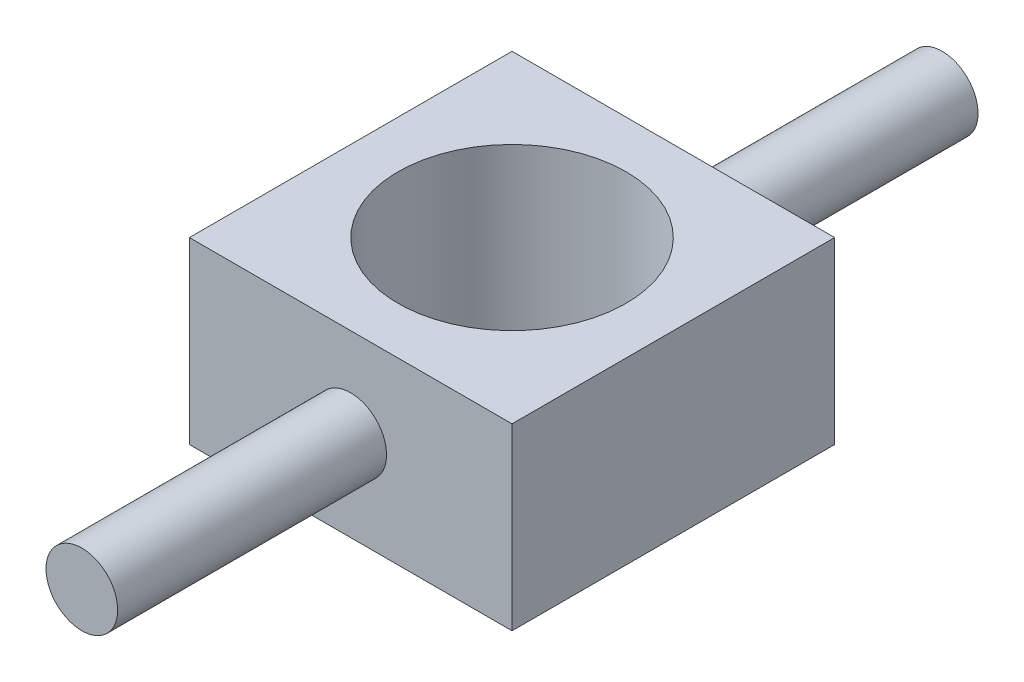
from build123d import *

# Parameters (mm, degrees)
BOSS_EXTRUDE1_DEPTH      = 10
BOSS_EXTRUDE1_DEPTH_BACK = 10
SKETCH1_W                = 36
SKETCH1_H                = 36
SKETCH2_R                = 12.725
CUT_EXTRUDE1_DEPTH       = 33.372828112
SKETCH5_R                = 4
BOSS_EXTRUDE2_DEPTH      = 30


with BuildPart() as part:
    # Sketch1 → Boss-Extrude1 (new, two sides: drawn at the far end of the back side and taken through both)
    with BuildSketch(Plane(origin=(0, 0, 0), x_dir=(1, 0, 0), z_dir=(0, 1, 0)).offset(-BOSS_EXTRUDE1_DEPTH_BACK)):
        Rectangle(SKETCH1_W, SKETCH1_H)
    extrude(amount=BOSS_EXTRUDE1_DEPTH + BOSS_EXTRUDE1_DEPTH_BACK)

    # Sketch2 → Cut-Extrude1 (cut, through all)
    with BuildSketch(Plane.XZ.offset(10)):
        Circle(SKETCH2_R)
    extrude(amount=-CUT_EXTRUDE1_DEPTH, mode=Mode.SUBTRACT)

    # Sketch5 → Boss-Extrude2 (add)
    with BuildSketch(Plane(origin=(0, 0, -18), x_dir=(-1, 0, 0), z_dir=(0, 0, -1))):
        Circle(SKETCH5_R)
    boss_extrude2 = extrude(amount=BOSS_EXTRUDE2_DEPTH)

    # Mirror1: Boss-Extrude2 across plane
    add(boss_extrude2.mirror(Plane.XY))


solid = part.part
